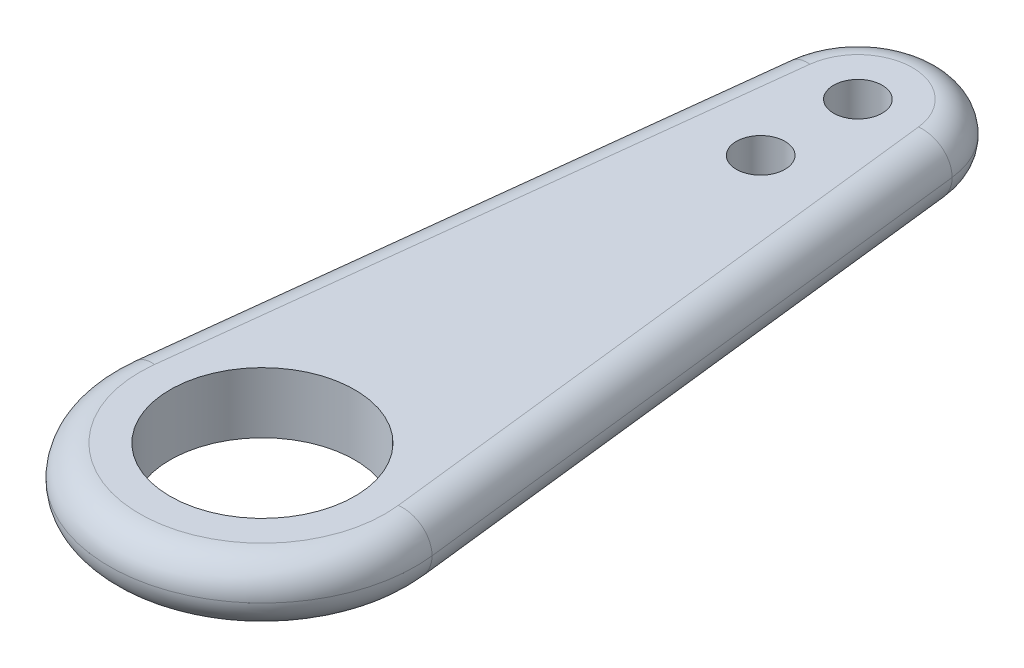
from build123d import *

# Parameters (mm, degrees)
CROQUIS2_R              = 0.8
CROQUIS2_R_2            = 3.04
SALIENTE_EXTRUIR1_DEPTH = 1
REDONDEO1_R             = 1


with BuildPart() as part:
    # Croquis2 → Saliente-Extruir1 (new, symmetric)
    with BuildSketch(Plane(origin=(0, 0, 0), x_dir=(1, 0, 0), z_dir=(0, 1, 0))):
        with BuildLine():
            Line((-2.781654184, 3.52), (-5.006977531, -15.824))
            ThreePointArc((-5.006977531, -15.824), (0, -21.44), (5.006977531, -15.824))
            Line((5.006977531, -15.824), (2.781654184, 3.52))
            ThreePointArc((2.781654184, 3.52), (0, 6), (-2.781654184, 3.52))
        make_face()
        with Locations(Location((0, 0, 0), (0, 0, 270))):
            Circle(CROQUIS2_R, mode=Mode.SUBTRACT)
        with Locations(Location((0, 3.2, 0), (0, 0, 270))):
            Circle(CROQUIS2_R, mode=Mode.SUBTRACT)
        with Locations(Location((0, -16.4, 0), (0, 0, 270))):
            Circle(CROQUIS2_R_2, mode=Mode.SUBTRACT)
    extrude(amount=SALIENTE_EXTRUIR1_DEPTH, both=True)

    # Redondeo1
    redondeo1_edges = [part.edges().sort_by_distance(p)[0] for p in [
        (-3.894315858, -1, 6.152),
        (0, -1, -6),
        (3.894315858, -1, 6.152),
        (-3.894315858, 1, 6.152),
        (0, 1, -6),
        (3.894315858, 1, 6.152),
        (0, -1, 21.44),
        (0, 1, 21.44),
    ]]
    fillet(redondeo1_edges, radius=REDONDEO1_R - 0.0001)  # a hair under: the kernel refuses the full size


solid = part.part
